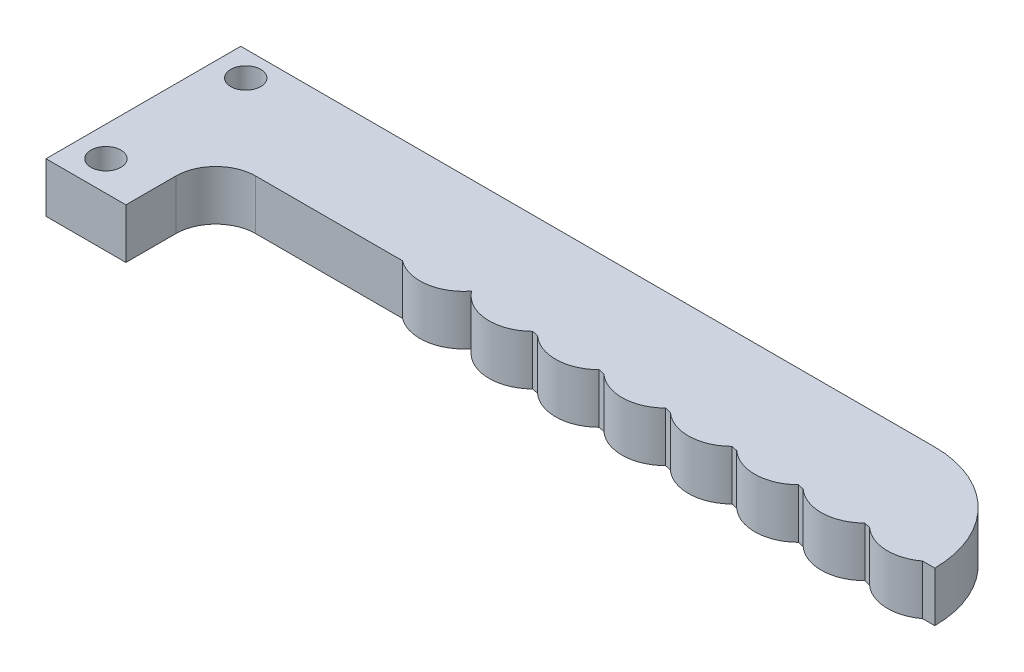
from build123d import *

# Parameters (mm, degrees)
BOSS_EXTRUDE1_DEPTH = 5
SKETCH2_W           = 8
SKETCH2_H           = 5
BOSS_EXTRUDE2_DEPTH = 9
FILLET1_R           = 4
SKETCH3_R           = 1.5
CUT_EXTRUDE1_DEPTH  = 10


with BuildPart() as part:
    # Sketch1 → Boss-Extrude1 (new body)
    with BuildSketch(Plane.XZ):
        with BuildLine():
            Line((-45, -0.875), (-45, -11.375))
            Line((-45, -11.375), (24.5, -11.375))
            ThreePointArc((24.5, -11.375), (31.924621202, -8.299621202), (35, -0.875))
            Line((35, -0.875), (33.775, -0.875))
            ThreePointArc((33.775, -0.875), (30.670128687, -0.026396946), (27.825, -1.531586558))
            ThreePointArc((27.825, -1.531586558), (24.5, 0), (21.175, -1.531586558))
            ThreePointArc((21.175, -1.531586558), (17.85, 0), (14.525, -1.531586558))
            ThreePointArc((14.525, -1.531586558), (11.2, 0), (7.875, -1.531586558))
            ThreePointArc((7.875, -1.531586558), (4.55, 0), (1.225, -1.531586558))
            ThreePointArc((1.225, -1.531586558), (-2.1, 0), (-5.425, -1.531586558))
            ThreePointArc((-5.425, -1.531586558), (-8.861439615, -0.00141952), (-12.215492713, -1.704609531))
            ThreePointArc((-12.215492713, -1.704609531), (-15.090502578, -0.040031141), (-18.305985425, -0.875))
            Line((-18.305985425, -0.875), (-45, -0.875))
        make_face()
    extrude(amount=-BOSS_EXTRUDE1_DEPTH)

    # Sketch2 → Boss-Extrude2 (add)
    with BuildSketch(Plane.XY.offset(-0.875)):
        with Locations((-41, 2.5)):
            Rectangle(SKETCH2_W, SKETCH2_H)
    extrude(amount=BOSS_EXTRUDE2_DEPTH)

    # Chamfer1
    # the kernel refuses this chamfer: 0.5, 0.339586842 mm, written as the material it adds along each edge
    with BuildSketch(Plane(origin=(-5.425, 0, -1.531586558), x_dir=(0.6961293101624768, 0, 0.7179164182080768), z_dir=(0, 1, 0))) as chamfer1_piece_1:
        with BuildLine():
            Line((0.546593526, 0), (0.018611268, -0.34666682))
            ThreePointArc((0.018611268, -0.34666682), (0.013013217, -0.178188087), (0, 0))
            ThreePointArc((0, 0), (0.281682829, -0.008536435), (0.546593526, 0))
        make_face()
    extrude(amount=5)
    with BuildSketch(Plane(origin=(1.225, 0, -1.531586558), x_dir=(-0.6795651691098796, 0, 0.7336151449722536), z_dir=(0, 1, 0)), Plane(origin=(7.875, 0, -1.531586558), x_dir=(-0.67956516910988, 0, 0.7336151449722534), z_dir=(0, 1, 0)), Plane(origin=(14.525, 0, -1.531586558), x_dir=(-0.679565169109884, 0, 0.7336151449722498), z_dir=(0, 1, 0)), Plane(origin=(21.175, 0, -1.531586558), x_dir=(-0.6795651691098812, 0, 0.7336151449722523), z_dir=(0, 1, 0)), Plane(origin=(27.825, 0, -1.531586558), x_dir=(-0.6795651691098773, 0, 0.7336151449722558), z_dir=(0, 1, 0))) as chamfer1_piece_2:
        with BuildLine():
            Line((0.347166046, 0), (0.029302401, 0.545807522))
            ThreePointArc((0.029302401, 0.545807522), (0.023624929, 0.280820137), (0, 0))
            ThreePointArc((0, 0), (0.178629479, 0.003441996), (0.347166046, 0))
        make_face()
    extrude(amount=5)

    # Fillet1
    fillet1_edges = [part.edges().sort_by_distance(p)[0] for p in [
        (-37, 2.5, -0.875),
    ]]
    fillet(fillet1_edges, radius=FILLET1_R)

    # Sketch3 → Cut-Extrude1 (cut)
    with BuildSketch(Plane(origin=(0, 5, 0), x_dir=(1, 0, 0), z_dir=(0, 1, 0))):
        with Locations(Location((-42, -5.125, 0), (0, 0, 270))):
            Circle(SKETCH3_R)
        with Locations(Location((-42, 8.875, 0), (0, 0, 270))):
            Circle(SKETCH3_R)
    extrude(amount=-CUT_EXTRUDE1_DEPTH, mode=Mode.SUBTRACT)


solid = part.part
